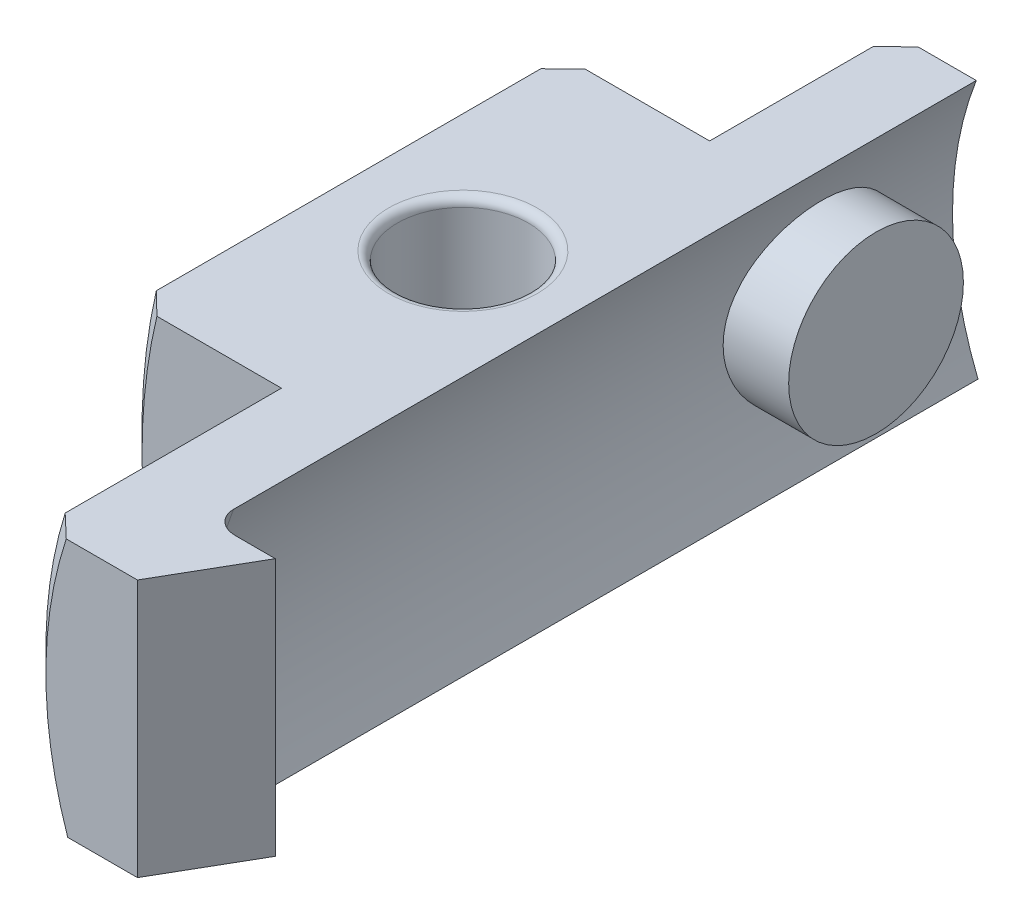
from build123d import *

# Parameters (mm, degrees)
EXTRUDE_2_DEPTH     = 19.5
SKETCH_3_R          = 2
EXTRUDE_3_DEPTH     = 1.5
SKETCH_4_W          = 9.8
SKETCH_4_H          = 5.9
EXTRUDE_4_DEPTH     = 0.5
SKETCH_4_3_W        = 9.8
SKETCH_4_3_H        = 5.9
EXTRUDE_5_DEPTH     = 8
CUT_EXTRUDE_1_DEPTH = 23.835608234
SKETCH_7_R          = 1.5
CUT_EXTRUDE_2_DEPTH = 25.167333429
FILLET_1_R          = 0.2
SKETCH_8_W          = 2
SKETCH_8_H          = 5.9
EXTRUDE_6_DEPTH     = 2
CHAMFER_1_SIZE2     = 2
CHAMFER_1_SIZE      = 1.154700538
FILLET_2_R          = 0.5
CHAMFER_2_SIZE      = 0.5


with BuildPart() as part:
    # 스케치2 → 보스-돌출2 (new body)
    with BuildSketch(Plane.XY):
        with BuildLine():
            Line((-7.455870171, 2.9), (-9.308732459, 2.9))
            ThreePointArc((-9.308732459, 2.9), (-9.749858874, -0.052458871), (-9.276987658, -3))
            Line((-9.276987658, -3), (-7.416198487, -3))
            ThreePointArc((-7.416198487, -3), (-7.999819157, -0.053790897), (-7.455870171, 2.9))
        make_face()
    extrude(amount=EXTRUDE_2_DEPTH)

    # 스케치3 → 보스-돌출3 (add)
    with BuildSketch(Plane(origin=(-8, 0, 0), x_dir=(0, 0, -1), z_dir=(1, 0, 0))):
        with Locations(Location((-3.25, 0, 0), (0, 0, 180))):
            Circle(SKETCH_3_R)
    extrude(amount=EXTRUDE_3_DEPTH)

    # 스케치4 → 보스-돌출4 (add, symmetric)
    with BuildSketch(Plane.ZY.offset(9.75)):
        with Locations((9.15, -0.05)):
            Rectangle(SKETCH_4_W, SKETCH_4_H)
    extrude(amount=EXTRUDE_4_DEPTH, both=True)

    # 스케치4<3> → 보스-돌출5 (add)
    with BuildSketch(Plane.ZY.offset(9.75)):
        with Locations((9.15, -0.05)):
            Rectangle(SKETCH_4_3_W, SKETCH_4_3_H)
    extrude(amount=EXTRUDE_5_DEPTH)

    # 스케치6 → 컷-돌출1 (cut, through all)
    with BuildSketch(Plane.XY.offset(14.05)):
        with BuildLine():
            Line((-12.672410978, 2.9), (-17.75, 2.9))
            Line((-17.75, 2.9), (-17.75, -3))
            Line((-17.75, -3), (-12.649110641, -3))
            ThreePointArc((-12.649110641, -3), (-12.999898626, -0.051339326), (-12.672410978, 2.9))
        make_face()
    extrude(amount=-CUT_EXTRUDE_1_DEPTH, mode=Mode.SUBTRACT)

    # 스케치7 → 컷-돌출2 (cut, through all)
    with BuildSketch(Plane(origin=(0, 2.9, 0), x_dir=(1, 0, 0), z_dir=(0, 1, 0))):
        with Locations(Location((-9.955870171, -9.25, 0), (0, 0, 180))):
            Circle(SKETCH_7_R)
    extrude(amount=-CUT_EXTRUDE_2_DEPTH, mode=Mode.SUBTRACT)

    # 필렛1
    fillet_1_edges = [part.edges().sort_by_distance(p)[0] for p in [
        (-8.455870171, -3, 9.25),
        (-8.455870171, 2.9, 9.25),
    ]]
    fillet(fillet_1_edges, radius=FILLET_1_R)

    # 스케치8 → 보스-돌출6 (add)
    with BuildSketch(Plane(origin=(-8, 0, 0), x_dir=(0, 0, -1), z_dir=(1, 0, 0))):
        with Locations((-18.5, -0.05)):
            Rectangle(SKETCH_8_W, SKETCH_8_H)
    extrude(amount=EXTRUDE_6_DEPTH)

    # 모따기1
    chamfer_1_edges = [part.edges().sort_by_distance(p)[0] for p in [
        (-6, -0.05, 19.5),
    ]]
    chamfer_1_side = [part.faces().sort_by_distance(p)[0] for p in [
        (-6.023094011, -0.05, 19.5),
    ]]
    chamfer(chamfer_1_edges, length=CHAMFER_1_SIZE - 0.0001, length2=CHAMFER_1_SIZE2 - 0.0001, reference=chamfer_1_side[0])  # a hair under: the kernel refuses the full size

    # 필렛2
    fillet_2_edges = [part.edges().sort_by_distance(p)[0] for p in [
        (-7.999819157, -0.053790897, 17.5),
    ]]
    fillet(fillet_2_edges, radius=FILLET_2_R)

    # 모따기2
    chamfer_2_edges = [part.edges().sort_by_distance(p)[0] for p in [
        (-9.749858874, -0.052458871, 0),
        (-12.999898626, -0.051339326, 4.25),
        (-12.999898626, -0.051339326, 14.05),
        (-9.749858874, -0.052458871, 19.5),
    ]]
    chamfer(chamfer_2_edges, length=CHAMFER_2_SIZE)


solid = part.part
